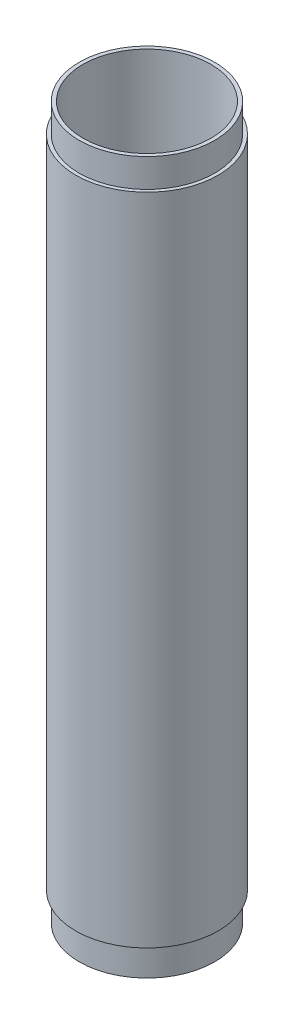
from build123d import *

# Parameters (mm, degrees)
SKETCH_1_R          = 25
SKETCH_1_R_2        = 22.5
EXTRUDE_1_DEPTH     = 230
SKETCH_2_R          = 24
CUT_EXTRUDE_1_DEPTH = 20
SKETCH_4_R          = 23.8
SKETCH_4_R_2        = 22.5
EXTRUDE_2_DEPTH     = 10
EXTRUDE_START       = 20
SKETCH_6_R          = 24
SKETCH_6_R_2        = 22.5
EXTRUDE_3_DEPTH     = 20
EXTRUDE_START_2     = 10
SKETCH_7_R          = 23.8
SKETCH_7_R_2        = 22.5
EXTRUDE_4_DEPTH     = 10


with BuildPart() as part:
    # Эскиз1 → Бобышка-Вытянуть1 (new body)
    with BuildSketch(Plane(origin=(0, 0, 0), x_dir=(1, 0, 0), z_dir=(0, 1, 0))):
        Circle(SKETCH_1_R)
        Circle(SKETCH_1_R_2, mode=Mode.SUBTRACT)
    extrude(amount=EXTRUDE_1_DEPTH)

    # Эскиз2 → Вырез-Вытянуть1 (cut)
    with BuildSketch(Plane(origin=(0, 0, 0), x_dir=(1, 0, 0), z_dir=(0, 1, 0))):
        Circle(SKETCH_2_R)
    extrude(amount=CUT_EXTRUDE_1_DEPTH, mode=Mode.SUBTRACT)

    # Эскиз4 → Бобышка-Вытянуть2 (add)
    with BuildSketch(Plane(origin=(0, 230, 0), x_dir=(1, 0, 0), z_dir=(0, 1, 0))):
        Circle(SKETCH_4_R)
        Circle(SKETCH_4_R_2, mode=Mode.SUBTRACT)
    extrude(amount=EXTRUDE_2_DEPTH)

    # Эскиз6 → Бобышка-Вытянуть3 (add)
    with BuildSketch(Plane.XZ.offset(-20).offset(EXTRUDE_START)):
        Circle(SKETCH_6_R)
        Circle(SKETCH_6_R_2, mode=Mode.SUBTRACT)
    extrude(amount=-EXTRUDE_3_DEPTH)

    # Эскиз7 → Бобышка-Вытянуть4 (add)
    with BuildSketch(Plane.XZ.offset(EXTRUDE_START_2)):
        Circle(SKETCH_7_R)
        Circle(SKETCH_7_R_2, mode=Mode.SUBTRACT)
    extrude(amount=-EXTRUDE_4_DEPTH)


solid = part.part
